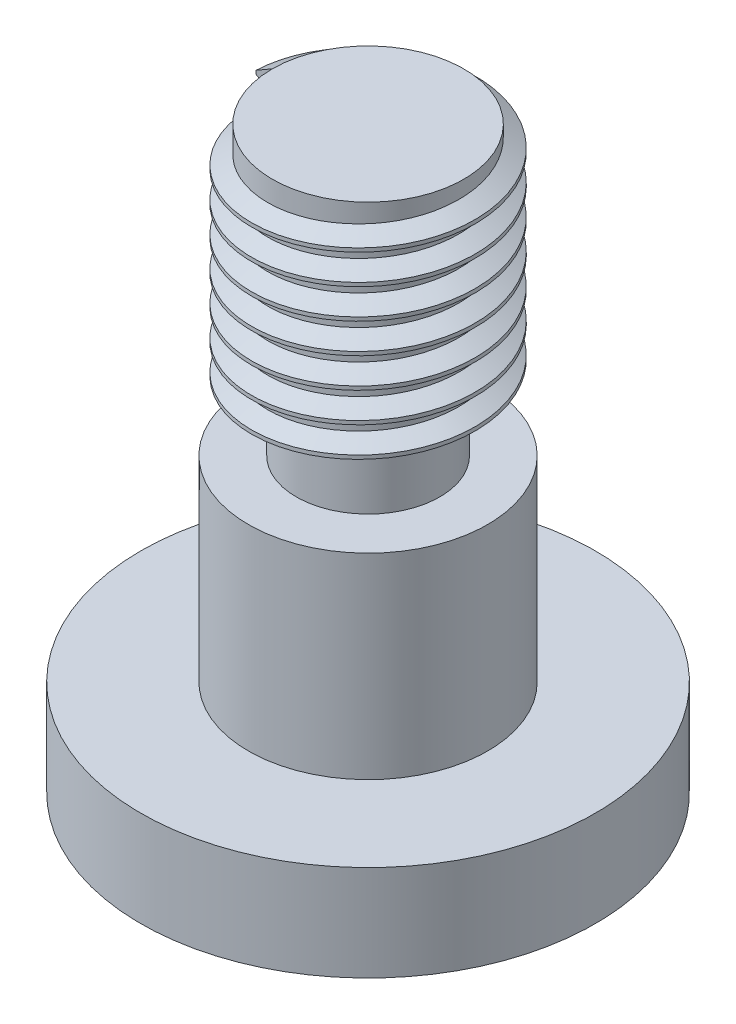
from build123d import *

# Parameters (mm, degrees)
THREAD1_PITCH = 1.25


with BuildPart() as part:
    # Sketch1 → Revolve1 (revolve)
    with BuildSketch(Plane.XY):
        Polygon((0, 24.2), (-4, 24.2), (-4, 15.2), (-3, 15.2), (-3, 12.2), (-5, 12.2), (-5, 4), (-9.5, 4), (-9.5, 0), (0, 0), align=None)
    revolve(axis=Axis((0, 24.2, 0), (0, -1, 0)))

    # Thread1: the profile of Thread Profile1 profile screwed along a right-hand helix of 7.2 turns, 8 arcs to a turn; built about Z, then put on its axis
    thread1_z = Axis((0, 0, 0), (0, 0, 1))
    thread1_corners = [(3.9997, 0, -0.000173205), (4.676582344, 0, 0.390624998), (4.676582344, 0, 0.546874998), (3.9997, 0, 0.937673202)]
    with BuildLine(mode=Mode.PRIVATE) as thread1_profile:
        Line(thread1_corners[0], thread1_corners[1])
        Line(thread1_corners[1], thread1_corners[2])
        Line(thread1_corners[2], thread1_corners[3])
        Line(thread1_corners[3], thread1_corners[0])
    thread1_cap = Face(thread1_profile.wire())
    thread1_turn_angles = [0, 22.5, 45, 67.5, 90, 112.5, 135, 157.5, 180, 202.5, 225, 247.5, 270, 292.5, 315, 337.5, 360]
    thread1_turn_weights = [1, 0.9238795325112867, 1, 0.9238795325112867, 1, 0.9238795325112867, 1, 0.9238795325112867, 1, 0.9238795325112867, 1, 0.9238795325112867, 1, 0.9238795325112867, 1, 0.9238795325112867, 1]
    thread1_turn_rails = [Edge.make_bspline([Vector(p[0], p[1], 0).rotate(thread1_z, thread1_turn_angles[k]) / thread1_turn_weights[k] + Vector(0, 0, p[2] + THREAD1_PITCH * thread1_turn_angles[k] / 360) for k in range(17)], [0, 0, 0, 1, 1, 2, 2, 3, 3, 4, 4, 5, 5, 6, 6, 7, 7, 8, 8, 8], 2, thread1_turn_weights) for p in thread1_corners]
    thread1_turn_sides = [Face.make_surface_from_curves(thread1_turn_rails[p[0]], thread1_turn_rails[p[1]]) for p in [(0, 1), (1, 2), (2, 3), (3, 0)]]
    thread1_last_angles = [2520, 2542.5, 2565, 2578.5, 2592]
    thread1_last_weights = [1, 0.9238795325112867, 1, 0.9723699203976757, 1]
    thread1_last_rails = [Edge.make_bspline([Vector(p[0], p[1], 0).rotate(thread1_z, thread1_last_angles[k]) / thread1_last_weights[k] + Vector(0, 0, p[2] + THREAD1_PITCH * thread1_last_angles[k] / 360) for k in range(5)], [0, 0, 0, 1, 1, 2, 2, 2], 2, thread1_last_weights) for p in thread1_corners]
    thread1_last_sides = [Face.make_surface_from_curves(thread1_last_rails[p[0]], thread1_last_rails[p[1]]) for p in [(0, 1), (1, 2), (2, 3), (3, 0)]]
    thread1 = Plane(origin=(0, 24.2, 0), x_dir=(-1, 0, 0), z_dir=(0, -1, 0)) * Solid(Shell([*[p.moved(Location((0, 0, THREAD1_PITCH * i))) for i in range(7) for p in thread1_turn_sides], *thread1_last_sides, thread1_cap, thread1_cap.rotate(thread1_z, 2592).moved(Location((0, 0, THREAD1_PITCH * 2592 / 360)))]))
    add(thread1)


solid = part.part
